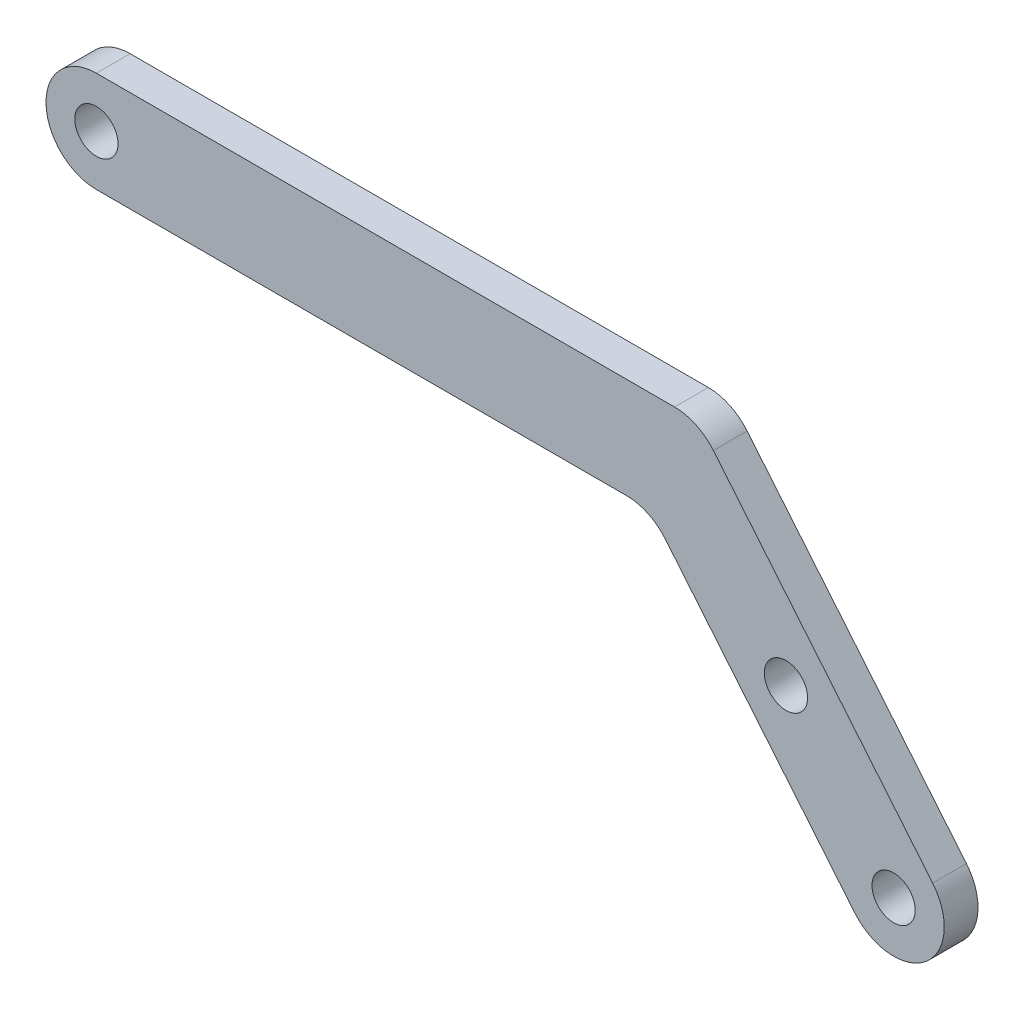
from build123d import *

# Parameters (mm, degrees)
SKETCH1_R           = 2.032
BOSS_EXTRUDE1_DEPTH = 3.175


with BuildPart() as part:
    # Sketch1 → Boss-Extrude1 (new body)
    with BuildSketch(Plane.XY):
        with BuildLine():
            Line((-64.847737492, 17.43793945), (-10.4775, 17.43793945))
            ThreePointArc((-10.4775, 17.43793945), (-8.460486641, 16.987158423), (-6.82728205, 15.720592517))
            Line((-6.82728205, 15.720592517), (13.789975554, -9.194215871))
            ThreePointArc((13.789975554, -9.194215871), (13.157086266, -15.899606512), (6.451695625, -15.266717225))
            Line((6.451695625, -15.266717225), (-11.349232409, 6.244713617))
            ThreePointArc((-11.349232409, 6.244713617), (-12.982436999, 7.511279522), (-14.999450358, 7.96206055))
            Line((-14.999450358, 7.96206055), (-64.847737492, 7.96206055))
            ThreePointArc((-64.847737492, 7.96206055), (-69.585676942, 12.7), (-64.847737492, 17.43793945))
        make_face()
        Circle(SKETCH1_R, mode=Mode.SUBTRACT)
        with Locations((-64.847737492, 12.7)):
            Circle(SKETCH1_R, mode=Mode.SUBTRACT)
        with Locations((10.120835589, -12.230466548)):
            Circle(SKETCH1_R, mode=Mode.SUBTRACT)
    extrude(amount=BOSS_EXTRUDE1_DEPTH)


solid = part.part
